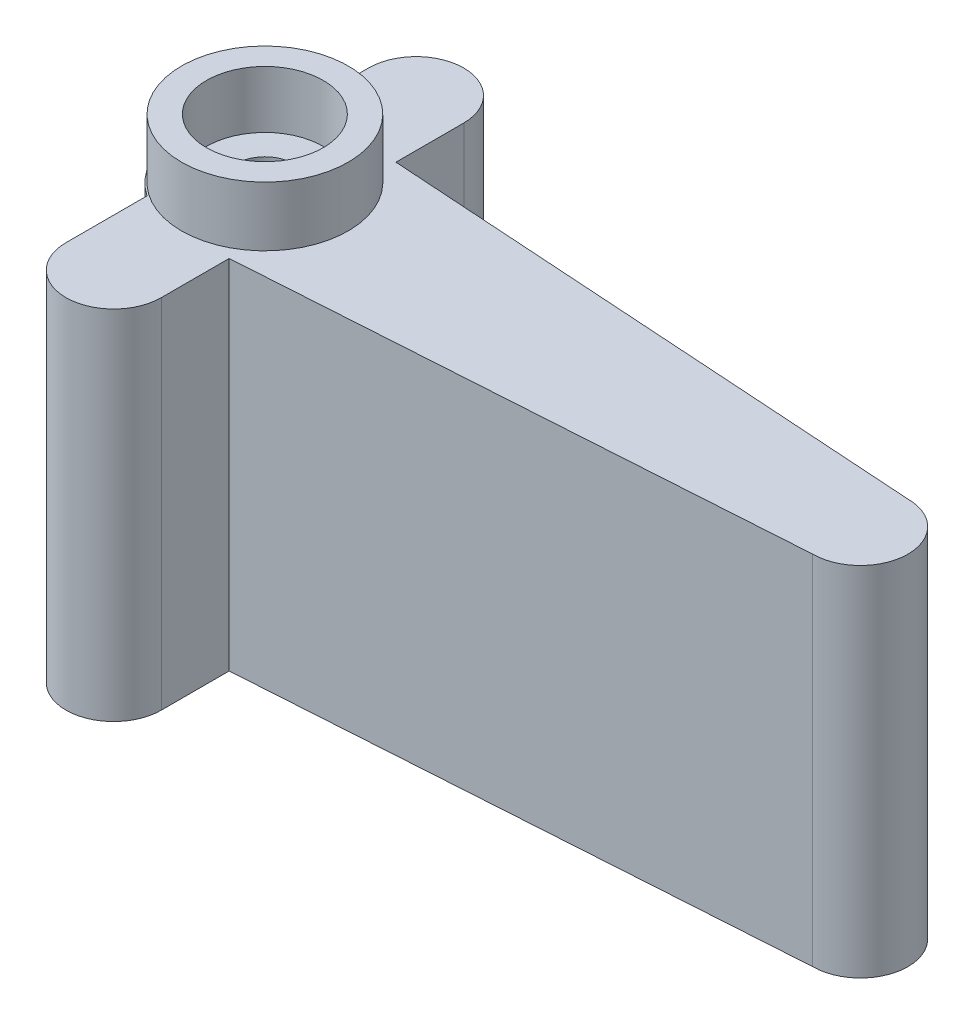
from build123d import *

# Parameters (mm, degrees)
BOSS_EXTRUDE1_DEPTH = 15
SKETCH2_R           = 2.35
CUT_EXTRUDE1_DEPTH  = 1
SKETCH3_R           = 3.5
SKETCH3_R_2         = 2.45
BOSS_EXTRUDE2_DEPTH = 2.5
SKETCH4_R           = 1.2
CUT_EXTRUDE2_DEPTH  = 32.995663769
SKETCH5_R           = 2.45
SKETCH5_R_2         = 1.2
BOSS_EXTRUDE3_DEPTH = 0.1


with BuildPart() as part:
    # Sketch1 → Boss-Extrude1 (new body)
    with BuildSketch(Plane(origin=(0, 0, 0), x_dir=(1, 0, 0), z_dir=(0, 1, 0))):
        with BuildLine():
            Line((2, 6.35), (2, 3.5))
            Line((2, 3.5), (25, 2))
            ThreePointArc((25, 2), (27, 0), (25, -2))
            Line((25, -2), (2, -3.5))
            Line((2, -3.5), (2, -6.35))
            ThreePointArc((2, -6.35), (0, -8.35), (-2, -6.35))
            Line((-2, -6.35), (-2, -2.95))
            ThreePointArc((-2, -2.95), (-3.564056677, 0), (-2, 2.95))
            Line((-2, 2.95), (-2, 6.35))
            ThreePointArc((-2, 6.35), (0, 8.35), (2, 6.35))
        make_face()
    extrude(amount=BOSS_EXTRUDE1_DEPTH)

    # Sketch2 → Cut-Extrude1 (cut)
    with BuildSketch(Plane.XZ):
        Circle(SKETCH2_R)
    extrude(amount=-CUT_EXTRUDE1_DEPTH, mode=Mode.SUBTRACT)

    # Sketch3 → Boss-Extrude2 (add)
    with BuildSketch(Plane(origin=(0, 15, 0), x_dir=(1, 0, 0), z_dir=(0, 1, 0))):
        Circle(SKETCH3_R)
        Circle(SKETCH3_R_2, mode=Mode.SUBTRACT)
    extrude(amount=BOSS_EXTRUDE2_DEPTH)

    # Sketch4 → Cut-Extrude2 (cut, through all)
    with BuildSketch(Plane(origin=(0, 15, 0), x_dir=(1, 0, 0), z_dir=(0, 1, 0))):
        Circle(SKETCH4_R)
    extrude(amount=-CUT_EXTRUDE2_DEPTH, mode=Mode.SUBTRACT)

    # Sketch5 → Boss-Extrude3 (add)
    with BuildSketch(Plane(origin=(0, 15, 0), x_dir=(1, 0, 0), z_dir=(0, 1, 0))):
        Circle(SKETCH5_R)
        Circle(SKETCH5_R_2, mode=Mode.SUBTRACT)
    extrude(amount=BOSS_EXTRUDE3_DEPTH)


solid = part.part
